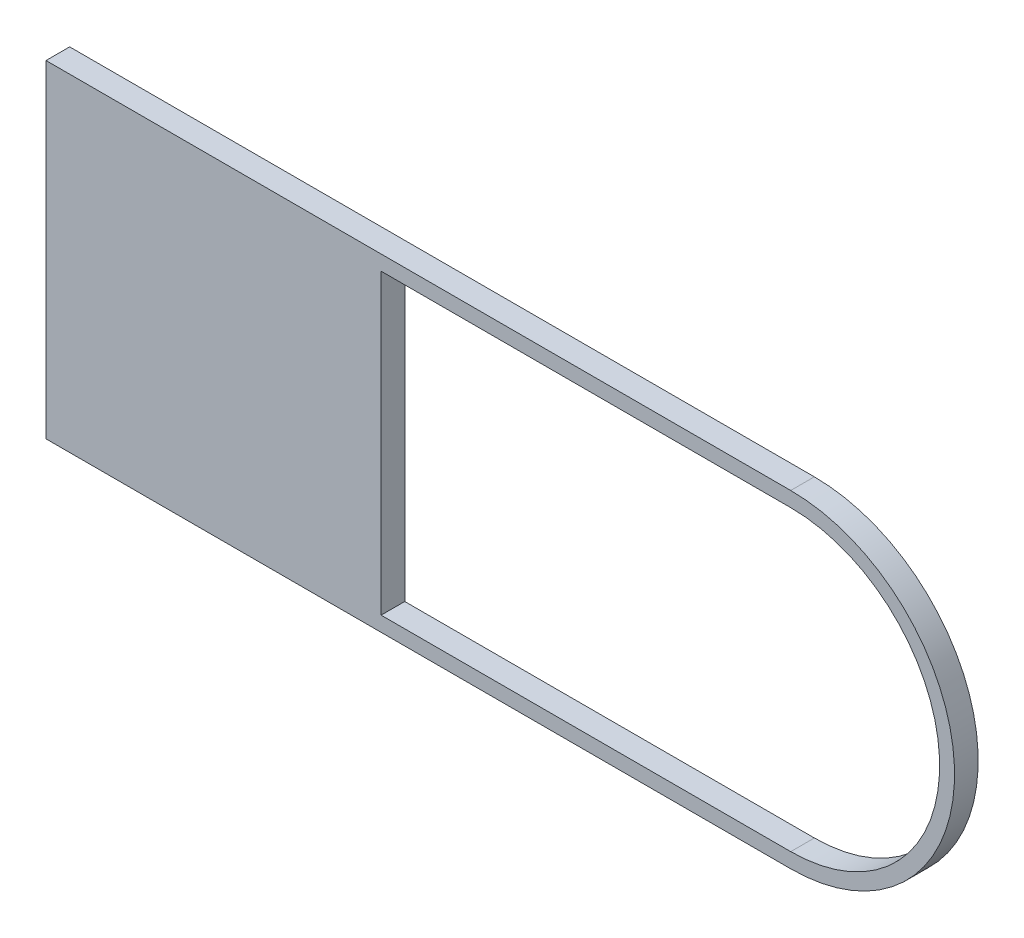
from build123d import *

# Parameters (mm, degrees)
BOSS_EXTRUDE1_DEPTH = 3.175


with BuildPart() as part:
    # Sketch1 → Boss-Extrude1 (new body)
    with BuildSketch(Plane.XY):
        with BuildLine():
            Line((0, 0), (100, 0))
            ThreePointArc((100, 0), (122, 22), (100, 44))
            Line((100, 44), (0, 44))
            Line((0, 44), (0, 0))
        make_face()
        with BuildLine():
            Line((45, 2), (45, 42))
            Line((45, 42), (100, 42))
            ThreePointArc((100, 42), (120, 22), (100, 2))
            Line((100, 2), (45, 2))
        make_face(mode=Mode.SUBTRACT)
    extrude(amount=BOSS_EXTRUDE1_DEPTH)


solid = part.part
